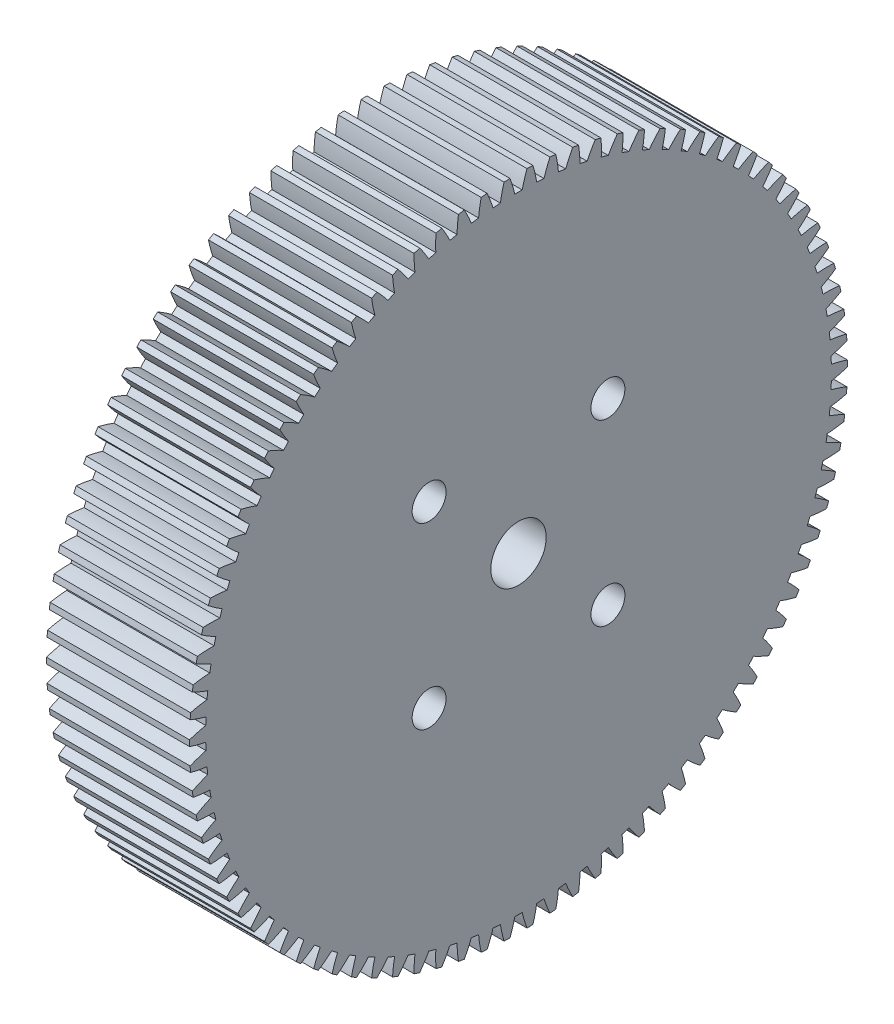
from build123d import *

# Parameters (mm, degrees)
BASPROSKE_W           = 16
BASPROSKE_H           = 36.8
TOOTHCUT_DEPTH        = 55.447038487
TEETHCUTS_COUNT       = 90
TEETHCUTS_ANGLE       = 356
BORSKE_R              = 3
BORE_DEPTH            = 50.0000508
F_6_CLEARANCE_HOLE1_D = 3.7973
SKETCH4_R             = 3.1
CUT_EXTRUDE1_DEPTH    = 55.438698979


with BuildPart() as part:
    # BasProSke → Base-Revolve (revolve)
    with BuildSketch(Plane(origin=(0, 0, 0), x_dir=(1, 0, 0), z_dir=(0, 1, 0))):
        with Locations((8, 18.4)):
            Rectangle(BASPROSKE_W, BASPROSKE_H)
    revolve(axis=Axis((-10, 0, 0), (1, 0, 0)))

    # TooCutSke → ToothCut (cut, through all)
    with BuildSketch(Plane(origin=(0, 0, 0), x_dir=(0, 0, -1), z_dir=(1, 0, 0))):
        with BuildLine():
            ThreePointArc((0.41009472, 34.996597311), (0, 34.999), (-0.41009472, 34.996597311))
            ThreePointArc((-0.41009472, 34.996597311), (-0.656283898, 35.913820865), (-0.962396213, 36.812822205))
            ThreePointArc((-0.962396213, 36.812822205), (0, 36.8254), (0.962396213, 36.812822205))
            ThreePointArc((0.962396213, 36.812822205), (0.656283898, 35.913820865), (0.41009472, 34.996597311))
        make_face()
    toothcut = extrude(amount=TOOTHCUT_DEPTH, mode=Mode.SUBTRACT)

    # TeethCuts: ToothCut ×90 about axis
    teethcuts_axis = Axis((-10, 0, 0), (1, 0, 0))
    for i in range(1, TEETHCUTS_COUNT):
        add(toothcut.rotate(teethcuts_axis, i * TEETHCUTS_ANGLE / (TEETHCUTS_COUNT - 1)), mode=Mode.SUBTRACT)

    # BorSke → Bore (cut, symmetric)
    with BuildSketch(Plane(origin=(0, 0, 0), x_dir=(0, 0, -1), z_dir=(1, 0, 0))):
        Circle(BORSKE_R)
    extrude(amount=BORE_DEPTH, both=True, mode=Mode.SUBTRACT)

    # #6 Clearance Hole1 (through all)
    with Locations(Plane(origin=(16, 0, 0), x_dir=(0, 0, -1), z_dir=(1, 0, 0))):
        with Locations((-10, -10), (10, -10), (-10, 10), (10, 10)):
            Hole(F_6_CLEARANCE_HOLE1_D / 2)

    # Sketch4 → Cut-Extrude1 (cut, through all)
    with BuildSketch(Plane(origin=(16, 0, 0), x_dir=(0, 0, -1), z_dir=(1, 0, 0))):
        Circle(SKETCH4_R)
    extrude(amount=-CUT_EXTRUDE1_DEPTH, mode=Mode.SUBTRACT)


solid = part.part
